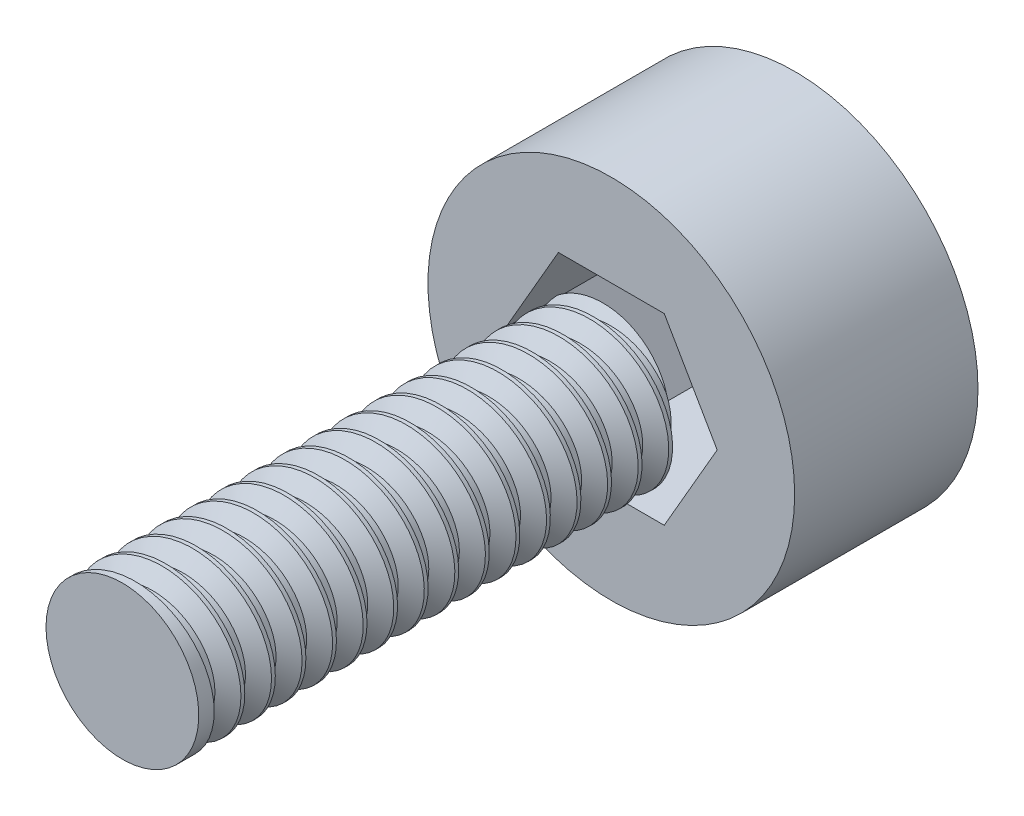
from build123d import *

# Parameters (mm, degrees)
SKETCH1_R           = 1.984375
BOSS_EXTRUDE1_DEPTH = 12.7
THREAD1_PITCH       = 0.79375
SKETCH6_R           = 4.7625
BOSS_EXTRUDE2_DEPTH = 4.7625


with BuildPart() as part:
    # Sketch1 → Boss-Extrude1 (new body)
    with BuildSketch(Plane.XY):
        Circle(SKETCH1_R)
    extrude(amount=BOSS_EXTRUDE1_DEPTH)

    # Thread1: the profile of Thread Profile1 profile screwed along a right-hand helix of 16 turns, 8 arcs to a turn; built about Z, then put on its axis
    thread1_z = Axis((0, 0, 0), (0, 0, 1))
    thread1_corners = [(1.984675, 0, -0.000173205), (1.984675, 0, 0.694704453), (1.554745212, 0, 0.446484374), (1.554745212, 0, 0.248046874)]
    with BuildLine(mode=Mode.PRIVATE) as thread1_profile:
        Line(thread1_corners[0], thread1_corners[1])
        Line(thread1_corners[1], thread1_corners[2])
        Line(thread1_corners[2], thread1_corners[3])
        Line(thread1_corners[3], thread1_corners[0])
    thread1_cap = Face(thread1_profile.wire())
    thread1_turn_angles = [0, 22.5, 45, 67.5, 90, 112.5, 135, 157.5, 180, 202.5, 225, 247.5, 270, 292.5, 315, 337.5, 360]
    thread1_turn_weights = [1, 0.9238795325112867, 1, 0.9238795325112867, 1, 0.9238795325112867, 1, 0.9238795325112867, 1, 0.9238795325112867, 1, 0.9238795325112867, 1, 0.9238795325112867, 1, 0.9238795325112867, 1]
    thread1_turn_rails = [Edge.make_bspline([Vector(p[0], p[1], 0).rotate(thread1_z, thread1_turn_angles[k]) / thread1_turn_weights[k] + Vector(0, 0, p[2] + THREAD1_PITCH * thread1_turn_angles[k] / 360) for k in range(17)], [0, 0, 0, 1, 1, 2, 2, 3, 3, 4, 4, 5, 5, 6, 6, 7, 7, 8, 8, 8], 2, thread1_turn_weights) for p in thread1_corners]
    thread1_turn_sides = [Face.make_surface_from_curves(thread1_turn_rails[p[0]], thread1_turn_rails[p[1]]) for p in [(0, 1), (1, 2), (2, 3), (3, 0)]]
    thread1 = Plane(origin=(0, 0, 12.7), x_dir=(-1, 0, 0), z_dir=(0, 0, -1)) * Solid(Shell([*[p.moved(Location((0, 0, THREAD1_PITCH * i))) for i in range(16) for p in thread1_turn_sides], thread1_cap, thread1_cap.rotate(thread1_z, 5760).moved(Location((0, 0, THREAD1_PITCH * 5760 / 360)))]))
    add(thread1, mode=Mode.SUBTRACT)


with BuildPart() as body_2:
    # Sketch6 → Boss-Extrude2 (new body)
    with BuildSketch(Plane.XY):
        Circle(SKETCH6_R)
        Polygon((2.749630657, 0), (1.374815329, 2.38125), (-1.374815329, 2.38125), (-2.749630657, 0), (-1.374815329, -2.38125), (1.374815329, -2.38125), align=None, mode=Mode.SUBTRACT)
    extrude(amount=-BOSS_EXTRUDE2_DEPTH)


solid = Compound([part.part, body_2.part])
